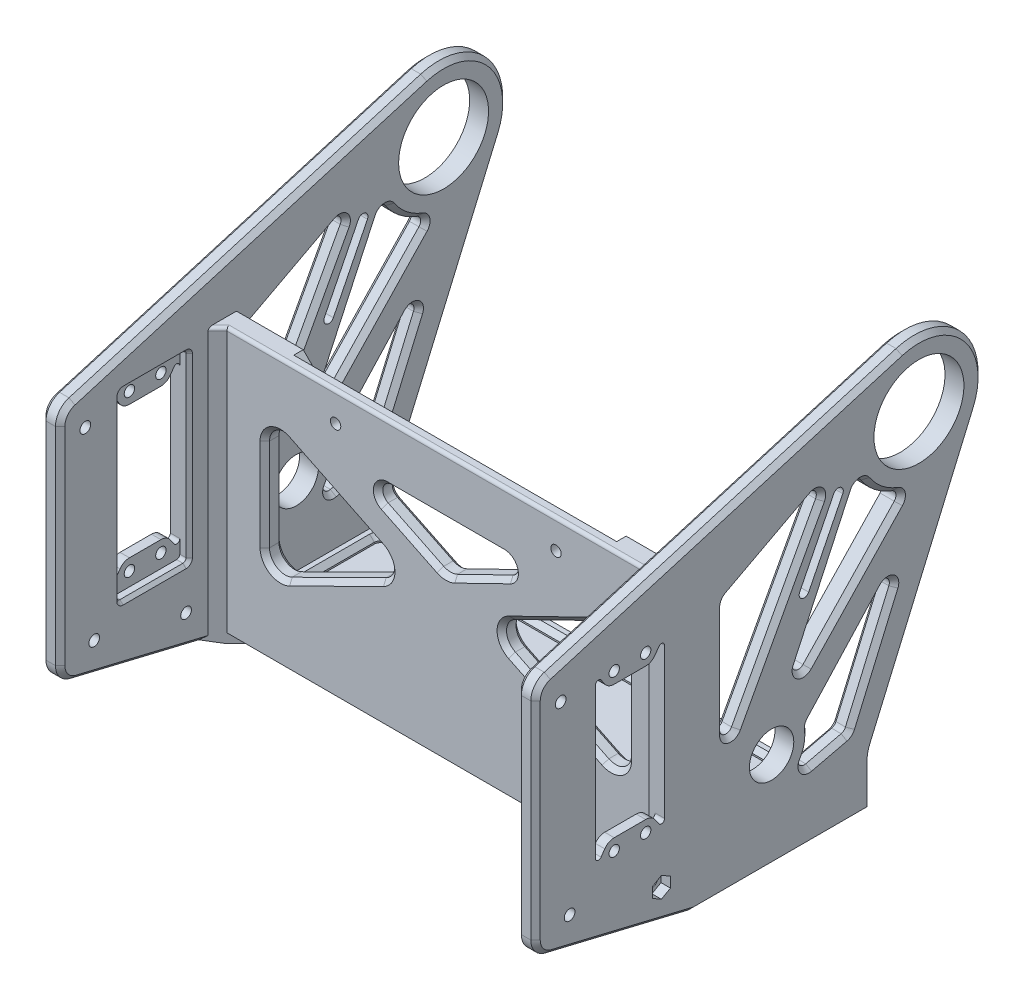
from build123d import *
from OCP.BRepFilletAPI import BRepFilletAPI_MakeFillet

# Parameters (mm, degrees)
SKETCH1_W                = 157
SKETCH1_H                = 87
SKETCH1_W_2              = 145
SKETCH1_H_2              = 75
BOSS_EXTRUDE1_DEPTH      = 50.8
SKETCH2_W                = 157
SKETCH2_H                = 87
BOSS_EXTRUDE2_DEPTH      = 6
SKETCH3_W                = 145
SKETCH3_H                = 7.840397899
CUT_EXTRUDE1_DEPTH       = 179.725040215
CUT_EXTRUDE2_DEPTH       = 179.725040215
FILLET2_R1               = 5
FILLET2_R2               = 3
SKETCH7_R                = 20.2875
SKETCH7_R_2              = 14.2875
BOSS_EXTRUDE3_DEPTH      = 6
FILLET3_R                = 10
CHAMFER2_SIZE            = 5
SKETCH10_R               = 7.05
CUT_EXTRUDE4_DEPTH       = 204.465040379
FILLET5_R                = 5
SKETCH12_R               = 1.65
CUT_EXTRUDE9_DEPTH       = 3
SKETCH12_7_R             = 1.65
CUT_EXTRUDE10_DEPTH      = 210.128764909
SKETCH13_R               = 1.65
BOSS_EXTRUDE4_DEPTH      = 6
FILLET6_R                = 1
FILLET6_OF_MIRROR4_R     = 1
CHAMFER3_SIZE            = 6
BOSS_EXTRUDE5_DEPTH      = 6
BOSS_EXTRUDE6_DEPTH      = 6
CUT_EXTRUDE11_DEPTH      = 219.472018017
CUT_EXTRUDE11_DEPTH_BACK = 10
SKETCH16_R               = 1.7
FILLET7_R                = 6
CUT_EXTRUDE12_DEPTH      = 3
CUT_EXTRUDE13_DEPTH      = 223.661228453
SKETCH19_W               = 22
SKETCH19_H               = 8
CUT_EXTRUDE14_DEPTH      = 3
FILLET8_R                = 1
CHAMFER4_SIZE            = 1
FILLET8_OF_MIRROR9_R     = 1
CHAMFER5_SIZE            = 1
CHAMFER9_SIZE            = 1.5
CHAMFER10_SIZE           = 1.5
CUT_EXTRUDE15_DEPTH      = 223.661228453
FILLET10_START           = 145
FILLET10_DEPTH           = 6
FILLET11_R               = 2
FILLET12_START           = -6
FILLET12_DEPTH           = 6
FILLET13_R               = 2
CHAMFER11_SIZE           = 1.5
SKETCH20_W               = 139
SKETCH20_H               = 34.8
CUT_EXTRUDE16_DEPTH      = 2
FILLET14_R               = 2
CHAMFER12_SIZE           = 1.5
CHAMFER13_SIZE           = 1.5
CHAMFER14_SIZE           = 3
CHAMFER15_SIZE           = 1.5
CHAMFER16_SIZE           = 3
FILLET15_R               = 1
FILLET16_R               = 1


with BuildPart() as part:
    # Sketch1 → Boss-Extrude1 (new body)
    with BuildSketch(Plane.XY):
        with Locations((72.5, 37.5)):
            Rectangle(SKETCH1_W, SKETCH1_H)
        with Locations((72.5, 37.5)):
            Rectangle(SKETCH1_W_2, SKETCH1_H_2, mode=Mode.SUBTRACT)
    extrude(amount=BOSS_EXTRUDE1_DEPTH)

    # Sketch2 → Boss-Extrude2 (add)
    with BuildSketch(Plane.XY.offset(50.8)):
        with Locations((72.5, 37.5)):
            Rectangle(SKETCH2_W, SKETCH2_H)
    extrude(amount=BOSS_EXTRUDE2_DEPTH)

    # Sketch3 → Cut-Extrude1 (cut, through all)
    with BuildSketch(Plane(origin=(0, 0, 50.8), x_dir=(-1, 0, 0), z_dir=(0, 0, -1))):
        with Locations((-72.5, 78.92019895)):
            Rectangle(SKETCH3_W, SKETCH3_H)
    extrude(amount=CUT_EXTRUDE1_DEPTH, mode=Mode.SUBTRACT)

    # Sketch5 → Cut-Extrude2 (cut, through all)
    with BuildSketch(Plane(origin=(0, 0, 50.8), x_dir=(-1, 0, 0), z_dir=(0, 0, -1))):
        Polygon((-130, 62.996404041), (-83.900811392, 40.5), (-130, 18.003595959), align=None)
        Polygon((-72.534927555, 47.159270504), (-104.039713028, 62.533605815), (-40.991844554, 62.552295009), align=None)
        Polygon((-61.169043718, 40.465910706), (-15, 62.996404041), (-15, 17.590444841), align=None)
    extrude(amount=-CUT_EXTRUDE2_DEPTH, mode=Mode.SUBTRACT)

    # Fillet2: one fillet with a radius per group of edges: ONE call of the kernel's fillet builder (fillet() takes one radius for all edges)
    fillet2_edges_1 = [part.edges().sort_by_distance(p)[0] for p in [
        (130, 62.996404041, 53.8),
        (130, 18.003595959, 53.8),
        (83.900811392, 40.5, 53.8),
        (61.169043718, 40.465910706, 53.8),
        (15, 17.590444841, 53.8),
        (15, 62.996404041, 53.8),
        (72.534927555, 47.159270504, 53.8),
    ]]
    fillet2_edges_2 = [part.edges().sort_by_distance(p)[0] for p in [
        (104.039713028, 62.533605815, 53.8),
        (40.991844554, 62.552295009, 53.8),
    ]]
    fillet2 = BRepFilletAPI_MakeFillet(part.part.solid().wrapped)
    for e in fillet2_edges_1:
        fillet2.Add(FILLET2_R1, e.wrapped)
    for e in fillet2_edges_2:
        fillet2.Add(FILLET2_R2, e.wrapped)
    add(Compound.cast(fillet2.Shape()), mode=Mode.REPLACE)

    # Sketch7 → Boss-Extrude3 (add)
    # profile 1 of 2: a face of its own
    with BuildSketch(Plane.ZY.offset(6)):
        with BuildLine():
            Line((-33.628509731, 87.964996486), (0, 10))
            Line((0, 10), (0, 81))
            Line((0, 81), (56.8, 81))
            Line((56.8, 81), (-5.520454784, 113.936579349))
            ThreePointArc((-5.520454784, 113.936579349), (2.376693152, 106.470586963), (5.2875, 96))
            ThreePointArc((5.2875, 96), (-10.897758839, 76.131575963), (-33.628509731, 87.964996486))
        make_face()
    # profile 2 of 2: a face of its own
    with BuildSketch(Plane.ZY.offset(6)):
        with Locations((-15, 96)):
            Circle(SKETCH7_R)
        with Locations((-15, 96)):
            Circle(SKETCH7_R_2, mode=Mode.SUBTRACT)
    boss_extrude3 = extrude(amount=-BOSS_EXTRUDE3_DEPTH)

    # Mirror1: Boss-Extrude3 across plane
    add(boss_extrude3.mirror(Plane.ZY.offset(-72.5)))

    # Fillet3
    fillet3_edges = [part.edges().sort_by_distance(p)[0] for p in [
        (-3, 10, 0),
        (148, 10, 0),
    ]]
    fillet(fillet3_edges, radius=FILLET3_R)

    # Chamfer2
    chamfer2_edges = [part.edges().sort_by_distance(p)[0] for p in [
        (72.5, 0, 0),
    ]]
    chamfer(chamfer2_edges, length=CHAMFER2_SIZE)

    # Sketch10 → Cut-Extrude4 (cut, through all)
    with BuildSketch(Plane(origin=(151, 0, 0), x_dir=(0, 0, -1), z_dir=(1, 0, 0))):
        with Locations((-31.8, 25)):
            Circle(SKETCH10_R)
    extrude(amount=-CUT_EXTRUDE4_DEPTH, mode=Mode.SUBTRACT)

    # Fillet5
    fillet5_edges = [part.edges().sort_by_distance(p)[0] for p in [
        (72.5, 0, 50.8),
    ]]
    fillet(fillet5_edges, radius=FILLET5_R)

    # Sketch12 → Cut-Extrude9 (cut)
    # profile 1 of 2: a face of its own
    with BuildSketch(Plane(origin=(0, 0, 50.8), x_dir=(-1, 0, 0), z_dir=(0, 0, -1))):
        with BuildLine():
            Line((-72.5, 66.795063192), (-72.5, 81))
            Line((-72.5, 81), (-123.78828295, 81))
            Line((-123.78828295, 81), (-111.047812236, 68.259529286))
            ThreePointArc((-111.047812236, 68.259529286), (-109.425695492, 67.17566553), (-107.51227833, 66.795063192))
            Line((-107.51227833, 66.795063192), (-72.5, 66.795063192))
        make_face()
        with Locations((-107.51227833, 71.795063192)):
            Circle(SKETCH12_R, mode=Mode.SUBTRACT)
    # profile 2 of 2: a face of its own
    with BuildSketch(Plane(origin=(0, 0, 50.8), x_dir=(-1, 0, 0), z_dir=(0, 0, -1))):
        with BuildLine():
            Line((-21.21171705, 81), (-72.5, 81))
            Line((-72.5, 81), (-72.5, 66.795063192))
            Line((-72.5, 66.795063192), (-37.48772167, 66.795063192))
            ThreePointArc((-37.48772167, 66.795063192), (-35.574304508, 67.17566553), (-33.952187764, 68.259529286))
            Line((-33.952187764, 68.259529286), (-21.21171705, 81))
        make_face()
        with Locations((-37.48772167, 71.795063192)):
            Circle(SKETCH12_R, mode=Mode.SUBTRACT)
    extrude(amount=-CUT_EXTRUDE9_DEPTH, mode=Mode.SUBTRACT)

    # Sketch12<7> → Cut-Extrude10 (cut, through all)
    with BuildSketch(Plane(origin=(0, 0, 50.8), x_dir=(-1, 0, 0), z_dir=(0, 0, -1))):
        with Locations((-107.51227833, 71.795063192)):
            Circle(SKETCH12_7_R)
        with Locations((-37.48772167, 71.795063192)):
            Circle(SKETCH12_7_R)
    extrude(amount=-CUT_EXTRUDE10_DEPTH, mode=Mode.SUBTRACT)

    # Sketch13 → Boss-Extrude4 (add)
    with BuildSketch(Plane(origin=(151, 0, 0), x_dir=(0, 0, -1), z_dir=(1, 0, 0))):
        Polygon((-56.8, -6), (-56.8, 81), (-106.8, 81), (-106.8, 6), align=None)
        with Locations((-81.80010225, 23.5)):
            Circle(SKETCH13_R, mode=Mode.SUBTRACT)
        with Locations((-71.80010225, 23.5)):
            Circle(SKETCH13_R, mode=Mode.SUBTRACT)
        with Locations((-81.80010225, 73)):
            Circle(SKETCH13_R, mode=Mode.SUBTRACT)
        with BuildLine():
            ThreePointArc((-68.800093231, 25.579049274), (-70.106884876, 26.733498867), (-71.80010225, 27.15))
            Line((-71.80010225, 27.15), (-81.80010225, 27.15))
            ThreePointArc((-81.80010225, 27.15), (-83.49337122, 26.733471849), (-84.800177618, 25.578953532))
            Line((-84.800177618, 25.578953532), (-87.8, 21.25))
            Line((-87.8, 21.25), (-87.8, 75.25))
            Line((-87.8, 75.25), (-84.800177618, 70.921046468))
            ThreePointArc((-84.800177618, 70.921046468), (-83.49337122, 69.766528151), (-81.80010225, 69.35))
            Line((-81.80010225, 69.35), (-71.80010225, 69.35))
            ThreePointArc((-71.80010225, 69.350000058), (-70.106357436, 69.766436086), (-68.799230137, 70.921255848))
            Line((-68.799230137, 70.921255848), (-65.8, 75.25))
            Line((-65.8, 75.25), (-65.8, 21.25))
            Line((-65.8, 21.25), (-68.800093231, 25.579049274))
        make_face(mode=Mode.SUBTRACT)
        with Locations((-71.799450587, 73)):
            Circle(SKETCH13_R, mode=Mode.SUBTRACT)
    boss_extrude4 = extrude(amount=-BOSS_EXTRUDE4_DEPTH)

    # Fillet6
    fillet6_edges = [part.edges().sort_by_distance(p)[0] for p in [
        (148, 21.25, 65.8),
        (148, 75.25, 65.8),
        (148, 75.25, 87.8),
        (148, 21.25, 87.8),
    ]]
    fillet(fillet6_edges, radius=FILLET6_R)

    # Mirror4: Boss-Extrude4 across plane
    add(boss_extrude4.mirror(Plane.ZY.offset(-72.5)))

    # Fillet6 of Mirror4
    fillet6_of_mirror4_edges = [part.edges().sort_by_distance(p)[0] for p in [
        (-3, 21.25, 65.8),
        (-3, 75.25, 65.8),
        (-3, 75.25, 87.8),
        (-3, 21.25, 87.8),
    ]]
    fillet(fillet6_of_mirror4_edges, radius=FILLET6_OF_MIRROR4_R)

    # Chamfer3
    chamfer3_edges = [part.edges().sort_by_distance(p)[0] for p in [
        (148, 81, 106.8),
        (-3, 81, 106.8),
    ]]
    chamfer(chamfer3_edges, length=CHAMFER3_SIZE)

    # Sketch14 → Boss-Extrude5 (add)
    with BuildSketch(Plane.ZY.offset(6)):
        with BuildLine():
            Line((100.8, 81), (106.8, 75))
            Line((106.8, 75), (106.8, 81))
            Line((106.8, 81), (-9.225708305, 115.448398692))
            ThreePointArc((-9.225708305, 115.448398692), (-7.335713696, 114.784072287), (-5.520454784, 113.936579349))
            Line((-5.520454784, 113.936579349), (56.8, 81))
            Line((56.8, 81), (100.8, 81))
        make_face()
    extrude(amount=-BOSS_EXTRUDE5_DEPTH)

    # Sketch15 → Boss-Extrude6 (add)
    with BuildSketch(Plane(origin=(151, 0, 0), x_dir=(0, 0, -1), z_dir=(1, 0, 0))):
        with BuildLine():
            Line((-106.8, 81), (-106.8, 75))
            Line((-106.8, 75), (-100.8, 81))
            Line((-100.8, 81), (-56.8, 81))
            Line((-56.8, 81), (5.520454784, 113.936579349))
            ThreePointArc((5.520454784, 113.936579349), (7.335713834, 114.784072344), (9.225708592, 115.448398777))
            Line((9.225708592, 115.448398777), (-106.8, 81))
        make_face()
    extrude(amount=-BOSS_EXTRUDE6_DEPTH)

    # Sketch16 → Cut-Extrude11 (cut, two sides: drawn at the far end of the back side and taken through both)
    with BuildSketch(Plane(origin=(0, 0, 0), x_dir=(0, 0, -1), z_dir=(1, 0, 0)).offset(-CUT_EXTRUDE11_DEPTH_BACK)):
        with Locations(Location((-66.8, 6, 0), (0, 0, 180))):
            Circle(SKETCH16_R)
        with Locations(Location((-98.8, 73, 0), (0, 0, 180))):
            Circle(SKETCH16_R)
        with Locations(Location((-95.971619059, 13.001188574, 0), (0, 0, 180))):
            Circle(SKETCH16_R)
    extrude(amount=CUT_EXTRUDE11_DEPTH + CUT_EXTRUDE11_DEPTH_BACK, mode=Mode.SUBTRACT)

    # Fillet7
    fillet7_edges = [part.edges().sort_by_distance(p)[0] for p in [
        (148, 6, 106.8),
        (-3, 6, 106.8),
        (-3, 81, 106.8),
        (148, 81, 106.8),
    ]]
    fillet(fillet7_edges, radius=FILLET7_R)

    # Sketch17 → Cut-Extrude12 (cut)
    with BuildSketch(Plane(origin=(151, 0, 0), x_dir=(0, 0, -1), z_dir=(1, 0, 0))):
        Polygon((-66.8, 9.290896534), (-69.65, 7.645448267), (-69.65, 4.354551733), (-66.8, 2.709103466), (-63.95, 4.354551733), (-63.95, 7.645448267), align=None)
    cut_extrude12 = extrude(amount=-CUT_EXTRUDE12_DEPTH, mode=Mode.SUBTRACT)

    # Mirror5: Cut-Extrude12 across plane
    add(cut_extrude12.mirror(Plane.ZY.offset(-72.5)), mode=Mode.SUBTRACT)

    # Sketch18 → Cut-Extrude13 (cut, through all)
    with BuildSketch(Plane.ZY.offset(6)):
        Polygon((21.161663685, 68.677001696), (14.431303731, 82.148848334), (11.614095688, 80.627772174), (18.344455642, 67.155925536), align=None)
        with BuildLine():
            Line((11.614095688, 80.627772174), (14.431303731, 82.148848334))
            Line((14.431303731, 82.148848334), (12.05305154, 86.909284477))
            ThreePointArc((12.05305154, 86.909284477), (9.906662831, 87.625535488), (9.19041182, 85.47914678))
            Line((9.19041182, 85.47914678), (11.614095688, 80.627772174))
        make_face()
        with BuildLine():
            Line((22.880686299, 65.236114555), (21.161663685, 68.677001696))
            Line((21.161663685, 68.677001696), (18.344455642, 67.155925536))
            Line((18.344455642, 67.155925536), (20.01804658, 63.805976857))
            ThreePointArc((20.01804658, 63.805976857), (22.164435288, 63.089725846), (22.880686299, 65.236114555))
        make_face()
    extrude(amount=-CUT_EXTRUDE13_DEPTH, mode=Mode.SUBTRACT)

    # Sketch19 → Cut-Extrude14 (cut)
    with BuildSketch(Plane(origin=(0, 0, 0), x_dir=(0, 0, -1), z_dir=(1, 0, 0))):
        Polygon((-87.8, 69.35), (-81.80010225, 69.35), (-65.8, 69.35), (-65.8, 77.35), (-87.8, 77.35), align=None)
        with Locations((-76.8, 23.15)):
            Rectangle(SKETCH19_W, SKETCH19_H)
    cut_extrude14 = extrude(amount=-CUT_EXTRUDE14_DEPTH, mode=Mode.SUBTRACT)

    # Fillet8
    fillet8_edges = [part.edges().sort_by_distance(p)[0] for p in [
        (-1.5, 77.35, 87.8),
        (-1.5, 77.35, 65.8),
        (-1.5, 19.15, 65.8),
        (-1.5, 19.15, 87.8),
    ]]
    fillet(fillet8_edges, radius=FILLET8_R)

    # Chamfer4
    chamfer4_edges = [part.edges().sort_by_distance(p)[0] for p in [
        (0, 19.15, 76.8),
        (0, 48.25, 87.8),
        (0, 48.25, 65.8),
        (0, 77.35, 76.8),
        (0, 19.442893219, 87.507106781),
        (0, 19.442893219, 66.092893219),
        (0, 77.057106781, 66.092893219),
        (0, 77.057106781, 87.507106781),
    ]]
    chamfer(chamfer4_edges, length=CHAMFER4_SIZE)

    # Mirror9: Cut-Extrude14 across plane
    add(cut_extrude14.mirror(Plane.ZY.offset(-72.5)), mode=Mode.SUBTRACT)

    # Fillet8 of Mirror9
    fillet8_of_mirror9_edges = [part.edges().sort_by_distance(p)[0] for p in [
        (146.5, 77.35, 87.8),
        (146.5, 77.35, 65.8),
        (146.5, 19.15, 65.8),
        (146.5, 19.15, 87.8),
    ]]
    fillet(fillet8_of_mirror9_edges, radius=FILLET8_OF_MIRROR9_R)

    # Chamfer5
    chamfer5_edges = [part.edges().sort_by_distance(p)[0] for p in [
        (145, 48.25, 87.8),
        (145, 19.15, 76.8),
        (145, 48.25, 65.8),
        (145, 77.35, 76.8),
        (145, 19.442893219, 87.507106781),
        (145, 19.442893219, 66.092893219),
        (145, 77.057106781, 66.092893219),
        (145, 77.057106781, 87.507106781),
    ]]
    chamfer(chamfer5_edges, length=CHAMFER5_SIZE)

    # Chamfer9
    chamfer9_edges = [part.edges().sort_by_distance(p)[0] for p in [
        (83.551509654, 52.535362569, 50.8),
        (83.551509654, 52.535362569, 56.8),
        (37.111870101, 52.205811432, 50.8),
        (37.111870101, 52.205811432, 56.8),
        (15, 40.320347146, 50.8),
        (15, 40.320347146, 56.8),
        (37.138867619, 28.559632629, 50.8),
        (37.138867619, 28.559632629, 56.8),
        (51.064829639, 60.224044598, 50.8),
        (51.064829639, 60.224044598, 56.8),
        (93.982706873, 60.212188982, 50.8),
        (93.982706873, 60.212188982, 56.8),
        (72.534927555, 47.722866464, 50.8),
        (72.534927555, 47.722866464, 56.8),
        (17.350861641, 59.233334694, 50.8),
        (17.350861641, 59.233334694, 56.8),
        (17.363631238, 21.399408866, 50.8),
        (17.363631238, 21.399408866, 56.8),
        (54.838064809, 40.446863893, 50.8),
        (54.838064809, 40.446863893, 56.8),
        (72.524557472, 62.54294781, 50.8),
        (72.524557472, 62.54294781, 56.8),
        (61.507086087, 52.540857141, 50.8),
        (61.507086087, 52.540857141, 56.8),
    ]]
    chamfer(chamfer9_edges, length=CHAMFER9_SIZE)

    # Chamfer10
    chamfer10_edges = [part.edges().sort_by_distance(p)[0] for p in [
        (107.95798501, 52.239900725, 50.8),
        (107.95798501, 52.239900725, 56.8),
        (107.95798501, 28.760099275, 50.8),
        (107.95798501, 28.760099275, 56.8),
        (130, 40.5, 50.8),
        (130, 40.5, 56.8),
        (90.301622785, 40.5, 50.8),
        (90.301622785, 40.5, 56.8),
        (127.649138359, 21.766665306, 50.8),
        (127.649138359, 21.766665306, 56.8),
        (127.649138359, 59.233334694, 50.8),
        (127.649138359, 59.233334694, 56.8),
    ]]
    chamfer(chamfer10_edges, length=CHAMFER10_SIZE)

    # Sketch8 → Cut-Extrude15 (cut, through all)
    with BuildSketch(Plane.ZY.offset(6)):
        with BuildLine():
            Line((-11.620030094, 62.189005636), (7.24746284, 18.446239985))
            Line((7.24746284, 18.446239985), (29.015476132, 13.27613857))
            ThreePointArc((29.015476132, 13.27613857), (21.574216515, 18.625374354), (20.047658672, 27.661761315))
            Line((20.047658672, 27.661761315), (-11.620030094, 62.189005636))
        make_face()
        with BuildLine():
            Line((-10.928651819, 76.125222511), (27.181348072, 36.129714927))
            ThreePointArc((27.181348072, 36.129714927), (27.514127152, 36.262051054), (27.850691867, 36.384439612))
            Line((27.850691867, 36.384439612), (3.752781989, 88.259468757))
            ThreePointArc((3.752781989, 88.259468757), (-2.075402811, 80.362306955), (-10.928651819, 76.125222511))
        make_face()
        Polygon((46.8, 30.524174725), (13.217506745, 92.722815779), (46.8, 74.974350084), align=None)
    extrude(amount=-CUT_EXTRUDE15_DEPTH, mode=Mode.SUBTRACT)

    # Fillet10: read off the stored shape, not the designer's step
    # Fillet10 outline → Fillet10 (add)
    with BuildSketch(Plane.YZ.offset(FILLET10_START)):
        with BuildLine():
            Line((62.189005636, -11.620030094), (53.472060786, -3.625024935))
            ThreePointArc((53.472060786, -3.625024935), (53.79888727, -6.186159873), (51.328086935, -6.935408447))
            Line((51.328086935, -6.935408447), (62.189005636, -11.620030094))
        make_face()
        with BuildLine():
            ThreePointArc((26.753805083, 19.878311037), (27.632266957, 19.811410788), (28.396753198, 19.373539011))
            Line((28.396753198, 19.373539011), (27.661761315, 20.047658672))
            ThreePointArc((27.661761315, 20.047658672), (27.209406325, 19.954282475), (26.753805083, 19.878311037))
        make_face()
        with BuildLine():
            Line((18.446239985, 7.24746284), (19.368020127, 6.849872975))
            ThreePointArc((19.368020127, 6.849872975), (18.628368202, 7.400364603), (18.214264727, 8.224163313))
            Line((18.214264727, 8.224163313), (18.446239985, 7.24746284))
        make_face()
        with BuildLine():
            ThreePointArc((15.544970967, 19.462863947), (16.328675113, 21.552714923), (18.559759645, 21.615413402))
            ThreePointArc((18.559759645, 21.615413402), (15.19317174, 24.797956049), (13.27613857, 29.015476132))
            Line((13.27613857, 29.015476132), (15.544970967, 19.462863947))
        make_face()
        with BuildLine():
            ThreePointArc((76.125222511, -10.928651819), (76.500453769, -9.400861403), (76.992940324, -7.906739908))
            ThreePointArc((76.992940324, -7.906739908), (75.567673384, -9.15652844), (73.739498052, -8.655397537))
            Line((73.739498052, -8.655397537), (76.125222511, -10.928651819))
        make_face()
        with BuildLine():
            ThreePointArc((84.613333787, 5.446549364), (85.765413051, 3.778513625), (84.868145291, 1.960674131))
            ThreePointArc((84.868145291, 1.960674131), (86.521358192, 2.937056774), (88.259468757, 3.752781989))
            Line((88.259468757, 3.752781989), (84.613333787, 5.446549364))
        make_face()
        with BuildLine():
            Line((36.129714927, 27.181348072), (37.004025027, 26.348255562))
            ThreePointArc((37.004025027, 26.348255562), (36.53474603, 27.033703619), (36.384439612, 27.850691867))
            ThreePointArc((36.384439612, 27.850691867), (36.262051054, 27.514127152), (36.129714927, 27.181348072))
        make_face()
        with BuildLine():
            Line((92.722815779, 13.217506745), (89.644797009, 19.041533811))
            ThreePointArc((89.644797009, 19.041533811), (89.284474996, 16.686531287), (86.926364246, 16.347145773))
            Line((86.926364246, 16.347145773), (92.722815779, 13.217506745))
        make_face()
        with BuildLine():
            ThreePointArc((73.769220101, 46.8), (74.801440627, 46.513044303), (75.537459593, 45.734520785))
            Line((75.537459593, 45.734520785), (74.974350084, 46.8))
            Line((74.974350084, 46.8), (73.769220101, 46.8))
        make_face()
        with BuildLine():
            Line((30.524174725, 46.8), (37.487881437, 43.040132747))
            ThreePointArc((37.487881437, 43.040132747), (36.499036994, 45.290033414), (38.438074707, 46.8))
            Line((38.438074707, 46.8), (30.524174725, 46.8))
        make_face()
    extrude(amount=FILLET10_DEPTH)

    # Fillet11
    fillet11_edges = [part.edges().sort_by_distance(p)[0] for p in [
        (148, 36.384439612, 27.850691867),
    ]]
    fillet(fillet11_edges, radius=FILLET11_R)

    # Fillet12: read off the stored shape, not the designer's step
    # Fillet12 outline → Fillet12 (add)
    with BuildSketch(Plane.YZ.offset(FILLET12_START)):
        with BuildLine():
            Line((62.189005636, -11.620030094), (53.472060786, -3.625024935))
            ThreePointArc((53.472060786, -3.625024935), (53.79888727, -6.186159873), (51.328086935, -6.935408447))
            Line((51.328086935, -6.935408447), (62.189005636, -11.620030094))
        make_face()
        with BuildLine():
            ThreePointArc((26.753805083, 19.878311037), (27.632266957, 19.811410788), (28.396753198, 19.373539011))
            Line((28.396753198, 19.373539011), (27.661761315, 20.047658672))
            ThreePointArc((27.661761315, 20.047658672), (27.209406325, 19.954282475), (26.753805083, 19.878311037))
        make_face()
        with BuildLine():
            Line((18.446239985, 7.24746284), (19.368020127, 6.849872975))
            ThreePointArc((19.368020127, 6.849872975), (18.628368202, 7.400364603), (18.214264727, 8.224163313))
            Line((18.214264727, 8.224163313), (18.446239985, 7.24746284))
        make_face()
        with BuildLine():
            ThreePointArc((15.544970967, 19.462863947), (16.328675113, 21.552714923), (18.559759645, 21.615413402))
            ThreePointArc((18.559759645, 21.615413402), (15.19317174, 24.797956049), (13.27613857, 29.015476132))
            Line((13.27613857, 29.015476132), (15.544970967, 19.462863947))
        make_face()
        with BuildLine():
            ThreePointArc((76.125222511, -10.928651819), (76.500453769, -9.400861403), (76.992940324, -7.906739908))
            ThreePointArc((76.992940324, -7.906739908), (75.567673384, -9.15652844), (73.739498052, -8.655397537))
            Line((73.739498052, -8.655397537), (76.125222511, -10.928651819))
        make_face()
        with BuildLine():
            ThreePointArc((84.613333787, 5.446549364), (85.765413051, 3.778513625), (84.868145291, 1.960674131))
            ThreePointArc((84.868145291, 1.960674131), (86.521358192, 2.937056774), (88.259468757, 3.752781989))
            Line((88.259468757, 3.752781989), (84.613333787, 5.446549364))
        make_face()
        with BuildLine():
            ThreePointArc((36.384439612, 27.850691867), (36.262051054, 27.514127152), (36.129714927, 27.181348072))
            ThreePointArc((36.129714927, 27.181348072), (36.974642437, 27.369924872), (37.820106893, 27.183770204))
            Line((37.820106893, 27.183770204), (36.384439612, 27.850691867))
        make_face()
        with BuildLine():
            Line((92.722815779, 13.217506745), (89.644797009, 19.041533811))
            ThreePointArc((89.644797009, 19.041533811), (89.284474996, 16.686531287), (86.926364246, 16.347145773))
            Line((86.926364246, 16.347145773), (92.722815779, 13.217506745))
        make_face()
        with BuildLine():
            ThreePointArc((73.769220101, 46.8), (74.801440627, 46.513044303), (75.537459593, 45.734520785))
            Line((75.537459593, 45.734520785), (74.974350084, 46.8))
            Line((74.974350084, 46.8), (73.769220101, 46.8))
        make_face()
        with BuildLine():
            Line((30.524174725, 46.8), (37.487881437, 43.040132747))
            ThreePointArc((37.487881437, 43.040132747), (36.499036994, 45.290033414), (38.438074707, 46.8))
            Line((38.438074707, 46.8), (30.524174725, 46.8))
        make_face()
    extrude(amount=FILLET12_DEPTH)

    # Fillet13
    # the kernel refuses this fillet: 2 mm, written as the material it adds along each edge
    with BuildSketch(Plane(origin=(-6, 36.129714927, 27.181348072), x_dir=(0, 0.7239657875746899, -0.6898358778878921), z_dir=(1, 0, 0))) as fillet13_piece_1:
        with BuildLine():
            CenterArc((9.918439032, 2), FILLET13_R, 108.700470648, 161.299529352)
            Line((9.27719749, 3.894415288), (9.213073335, 4.083856817))
            ThreePointArc((9.213073335, 4.083856817), (1.157990923, 1.357288095), (-0.186335662, 0.072656872))
            Line((-0.186335662, 0.072656872), (0, -0.2))
            Line((0, -0.2), (9.918439032, -0.2))
            Line((9.918439032, -0.2), (9.918439032, 0))
        make_face()
    extrude(amount=6)

    # Chamfer11
    chamfer11_edges = [part.edges().sort_by_distance(p)[0] for p in [
        (145, 35.348053531, -0.042767736),
        (151, 35.348053531, -0.042767736),
        (151, 40.934406992, 7.874257038),
        (145, 40.934406992, 7.874257038),
        (145, 16.879617847, 13.84351363),
        (151, 16.879617847, 13.84351363),
        (151, 22.500990187, 20.011978539),
        (145, 22.500990187, 20.011978539),
        (151, 58.524911752, 5.841927719),
        (151, 80.143455451, -2.344856729),
        (151, 62.207122841, 29.69363926),
        (145, 62.207122841, 29.69363926),
        (145, 82.591128301, 32.388027298),
        (151, 82.591128301, 32.388027298),
        (145, 56.103647404, 46.8),
        (151, 56.103647404, 46.8),
        (145, 53.79888727, -6.186159873),
        (151, 53.79888727, -6.186159873),
        (145, 18.628368202, 7.400364603),
        (151, 18.628368202, 7.400364603),
        (145, 27.632266957, 19.811410788),
        (151, 27.632266957, 19.811410788),
        (145, 16.328675113, 21.552714923),
        (151, 16.328675113, 21.552714923),
        (151, 75.567673384, -9.15652844),
        (151, 85.765413051, 3.778513625),
        (145, 89.284474996, 16.686531287),
        (151, 89.284474996, 16.686531287),
        (145, 74.801440627, 46.513044303),
        (151, 74.801440627, 46.513044303),
        (145, 36.499036994, 45.290033414),
        (151, 36.499036994, 45.290033414),
        (151, 65.072964845, 14.523788596),
        (151, 43.037149464, 22.913281496),
        (0, 56.103647404, 46.8),
        (-6, 56.103647404, 46.8),
        (-6, 62.207122841, 29.69363926),
        (0, 62.207122841, 29.69363926),
        (0, 82.591128301, 32.388027298),
        (-6, 82.591128301, 32.388027298),
        (0, 65.072964845, 14.523788596),
        (-6, 58.524911752, 5.841927719),
        (-6, 80.143455451, -2.344856729),
        (0, 80.143455451, -2.344856729),
        (-6, 22.500990187, 20.011978539),
        (0, 22.500990187, 20.011978539),
        (0, 16.879617847, 13.84351363),
        (-6, 16.879617847, 13.84351363),
        (0, 35.348053531, -0.042767736),
        (-6, 35.348053531, -0.042767736),
        (-6, 40.934406992, 7.874257038),
        (0, 40.934406992, 7.874257038),
        (-6, 36.499036994, 45.290033414),
        (0, 36.499036994, 45.290033414),
        (-6, 89.284474996, 16.686531287),
        (0, 89.284474996, 16.686531287),
        (-6, 74.801440627, 46.513044303),
        (0, 74.801440627, 46.513044303),
        (-6, 75.567673384, -9.15652844),
        (0, 75.567673384, -9.15652844),
        (-6, 85.765413051, 3.778513625),
        (0, 85.765413051, 3.778513625),
        (-6, 16.328675113, 21.552714923),
        (0, 16.328675113, 21.552714923),
        (-6, 18.628368202, 7.400364603),
        (0, 18.628368202, 7.400364603),
        (-6, 53.79888727, -6.186159873),
        (0, 53.79888727, -6.186159873),
        (-6, 27.632266957, 19.811410788),
        (0, 27.632266957, 19.811410788),
        (-6, 65.072964845, 14.523788596),
        (0, 58.524911752, 5.841927719),
        (-6, 43.037149464, 22.913281496),
        (0, 43.037149464, 22.913281496),
    ]]
    chamfer(chamfer11_edges, length=CHAMFER11_SIZE)

    # Sketch20 → Cut-Extrude16 (cut)
    with BuildSketch(Plane(origin=(0, 0, 0), x_dir=(1, 0, 0), z_dir=(0, 1, 0))):
        with Locations((72.5, -25.4)):
            Rectangle(SKETCH20_W, SKETCH20_H)
    extrude(amount=-CUT_EXTRUDE16_DEPTH, mode=Mode.SUBTRACT)

    # Fillet14
    fillet14_edges = [part.edges().sort_by_distance(p)[0] for p in [
        (3, -1, 8),
        (142, -1, 8),
        (142, -1, 42.8),
        (3, -1, 42.8),
    ]]
    fillet(fillet14_edges, radius=FILLET14_R)

    # Chamfer12
    chamfer12_edges = [part.edges().sort_by_distance(p)[0] for p in [
        (3, 0, 25.4),
        (72.5, 0, 8),
        (72.5, 0, 42.8),
        (142, 0, 25.4),
        (3.585786438, 0, 8.585786438),
        (3.585786438, 0, 42.214213562),
        (141.414213562, 0, 8.585786438),
        (141.414213562, 0, 42.214213562),
    ]]
    chamfer(chamfer12_edges, length=CHAMFER12_SIZE)

    # Chamfer13
    chamfer13_edges = [part.edges().sort_by_distance(p)[0] for p in [
        (-6, 0.967648075, 0),
        (151, 49.930430609, -17.223124926),
        (-6, 49.930430609, -17.223124926),
        (151, 9.95734971, -0.206568559),
        (-6, 9.95734971, -0.206568559),
        (151, 0.967648075, 0),
        (-6, 109.469988, -30.170434388),
        (151, 109.469987888, -30.170434487),
        (-6, -0.551971474, 79.500118857),
        (-6, 98.861392326, 46.641015122),
        (-6, 43.626464905, 106.8),
        (-6, 80.110972604, 105.608660484),
        (-6, 7.015641727, 105.511763273),
        (151, 43.626464905, 106.8),
        (151, 98.861392369, 46.641014979),
        (151, -0.551971474, 79.500118857),
        (151, 80.110972604, 105.608660484),
        (151, 7.015641727, 105.511763273),
        (151, -6, 28.4),
        (-6, -6, 28.4),
    ]]
    chamfer(chamfer13_edges, length=CHAMFER13_SIZE)

    # Chamfer14
    chamfer14_edges = [part.edges().sort_by_distance(p)[0] for p in [
        (145, 37.5, 56.8),
        (0, 37.5, 56.8),
    ]]
    chamfer(chamfer14_edges, length=CHAMFER14_SIZE)

    # Chamfer15
    chamfer15_edges = [part.edges().sort_by_distance(p)[0] for p in [
        (145, 1.467648075, 0),
        (0, 1.467648075, 0),
        (145, 49.930430609, -17.223124926),
        (0, 49.930430609, -17.223124926),
        (145, 9.95734971, -0.206568559),
        (0, 9.95734971, -0.206568559),
        (0, 109.469988, -30.170434388),
        (0, 98.861392326, 46.641015122),
        (145, 109.469987888, -30.170434487),
        (145, 98.861392369, 46.641014979),
        (0, -0.191971474, 81.000118857),
        (0, 43.626464905, 106.8),
        (0, 80.110972604, 105.608660484),
        (0, 7.015641727, 105.511763273),
        (145, 43.626464905, 106.8),
        (145, -0.191971474, 81.000118857),
        (145, 80.110972604, 105.608660484),
        (145, 7.015641727, 105.511763273),
    ]]
    chamfer(chamfer15_edges, length=CHAMFER15_SIZE)

    # Chamfer16
    chamfer16_edges = [part.edges().sort_by_distance(p)[0] for p in [
        (72.5, -6, 56.8),
    ]]
    chamfer(chamfer16_edges, length=CHAMFER16_SIZE)

    # Fillet15
    fillet15_edges = [part.edges().sort_by_distance(p)[0] for p in [
        (72.5, 81, 56.8),
    ]]
    fillet(fillet15_edges, radius=FILLET15_R)

    # Fillet16
    fillet16_edges = [part.edges().sort_by_distance(p)[0] for p in [
        (143, 81, 57.8),
        (2, 81, 57.8),
    ]]
    fillet(fillet16_edges, radius=FILLET16_R)


solid = part.part
